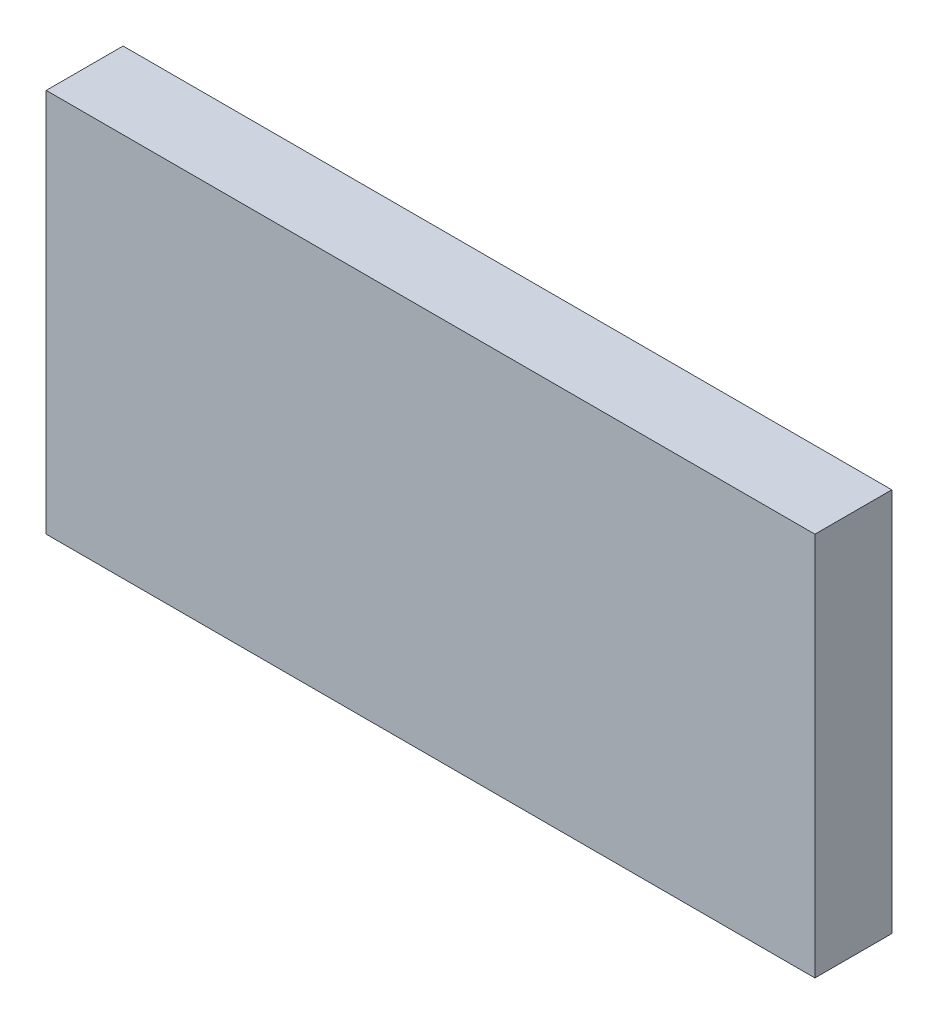
from build123d import *

# Parameters (mm, degrees)
SKETCH_1_W      = 100
SKETCH_1_H      = 50
EXTRUDE_1_DEPTH = 10


with BuildPart() as part:
    # Эскиз1 → Бобышка-Вытянуть1 (new body)
    with BuildSketch(Plane.XY):
        Rectangle(SKETCH_1_W, SKETCH_1_H)
    extrude(amount=EXTRUDE_1_DEPTH)


solid = part.part
